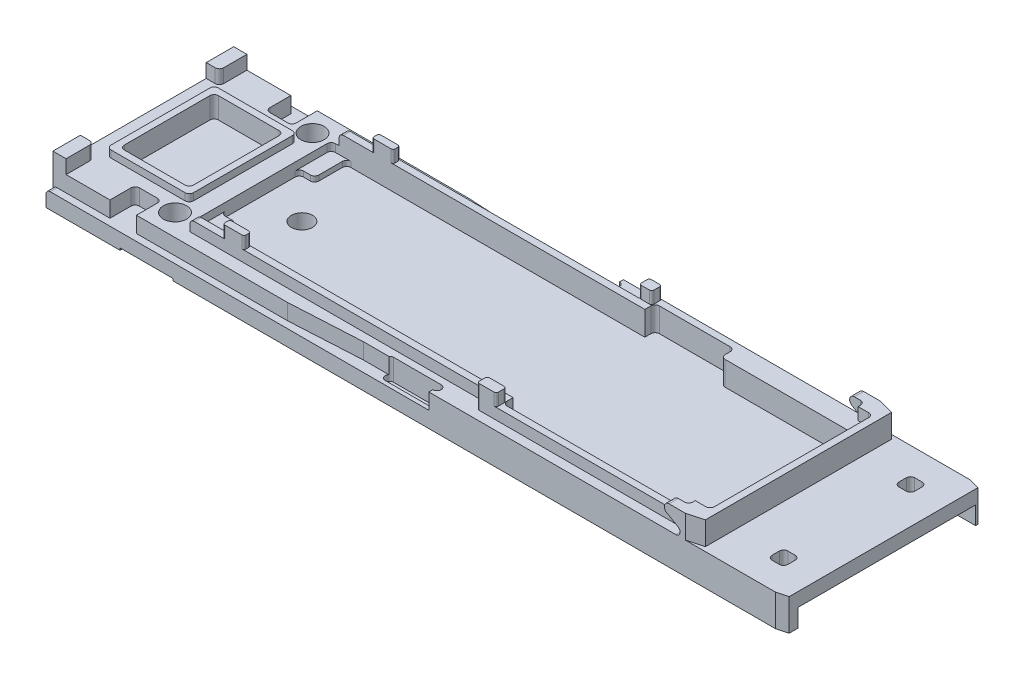
from build123d import *
from OCP.BRepFilletAPI import BRepFilletAPI_MakeChamfer

# Parameters (mm, degrees)
SKETCH1_W                                    = 70
SKETCH1_H                                    = 18.4
BOSS_EXTRUDE1_DEPTH                          = 4.05
CUT_EXTRUDE1_DEPTH                           = 2.28
SKETCH5_W                                    = 6.55
SKETCH5_H                                    = 8.9
CUT_EXTRUDE2_DEPTH                           = 2.38
SKETCH17_W                                   = 70
SKETCH17_H                                   = 18.4
CUT_EXTRUDE8_DEPTH                           = 1.05
SKETCH18_W                                   = 7.8
SKETCH18_H                                   = 10.15
SKETCH18_W_2                                 = 6.55
SKETCH18_H_2                                 = 8.9
BOSS_EXTRUDE3_DEPTH                          = 3.67
CSK_FOR_M2_COUNTERSUNK_FLAT_HEAD_SCR_2_COUNT = 2
CSK_FOR_M2_COUNTERSUNK_FLAT_HEAD_SCR_2_PITCH = 13
CUT_EXTRUDE5_DEPTH                           = 2.55
SKETCH19_W                                   = 1.25
SKETCH19_H                                   = 2.6
BOSS_EXTRUDE4_DEPTH                          = 4.3
SKETCH20_W                                   = 2.5
SKETCH20_H                                   = 2.385
CUT_EXTRUDE9_DEPTH                           = 1.5
SKETCH21_W                                   = 2
SKETCH21_H                                   = 0.65
BOSS_EXTRUDE5_DEPTH                          = 5.2
BOSS_EXTRUDE6_DEPTH                          = 5.2
CHAMFER2_SIZE                                = 1.5
CHAMFER2_SIZE2                               = 0.401923789
CHAMFER1_SIZE                                = 1
CHAMFER1_SIZE2                               = 0.267949192
CUT_EXTRUDE10_DEPTH                          = 37.313083042
CUT_EXTRUDE7_DEPTH                           = 0.2
CHAMFER2_OF_MIRROR1_SIZE2                    = 1.5
CHAMFER2_OF_MIRROR1_SIZE                     = 0.401923789
CUT_EXTRUDE12_DEPTH                          = 0.875
CUT_EXTRUDE13_START                          = -0.875
CUT_EXTRUDE13_DEPTH                          = 0.875
SKETCH26_W                                   = 1.8
SKETCH26_H                                   = 0.95
SKETCH26_W_2                                 = 1.18
BOSS_EXTRUDE8_DEPTH                          = 5.2
FILLET1_R                                    = 0.4
FILLET2_R                                    = 0.2
SKETCH23_W                                   = 0.65
SKETCH23_H                                   = 15.4
BOSS_EXTRUDE7_DEPTH                          = 1.15
SKETCH27_W                                   = 13.1
SKETCH27_H                                   = 1.275
BOSS_EXTRUDE9_DEPTH                          = 2.28
FILLET3_R                                    = 0.4
CUT_EXTRUDE11_DEPTH                          = 1.7
SKETCH31_W                                   = 1.45
SKETCH31_H                                   = 3.025
BOSS_EXTRUDE10_DEPTH                         = 0.5
SKETCH32_W                                   = 4.5
SKETCH32_H                                   = 0.65
CUT_EXTRUDE14_DEPTH                          = 0.55
CUT_EXTRUDE15_DEPTH                          = 37.43765223
FILLET5_R                                    = 0.4
FILLET6_R                                    = 0.4
FILLET7_R                                    = 0.4
FILLET8_R                                    = 0.4
SKETCH34_R                                   = 1
CUT_EXTRUDE16_DEPTH                          = 37.351133407


with BuildPart() as part:
    # Sketch1 → Boss-Extrude1 (new body)
    with BuildSketch(Plane(origin=(0, 0, 0), x_dir=(1, 0, 0), z_dir=(0, 1, 0))):
        Rectangle(SKETCH1_W, SKETCH1_H)
    extrude(amount=BOSS_EXTRUDE1_DEPTH)

    # Sketch2 → Cut-Extrude1 (cut)
    with BuildSketch(Plane(origin=(0, 4.05, 0), x_dir=(1, 0, 0), z_dir=(0, 1, 0))):
        Polygon((-23.95, 6.725), (-23.95, -6.725), (6.7, -6.725), (6.7, -7.7), (26.3, -7.7), (26.3, 7.7), (5.7, 7.7), (5.7, 6.725), align=None)
    extrude(amount=-CUT_EXTRUDE1_DEPTH, mode=Mode.SUBTRACT)

    # Sketch5 → Cut-Extrude2 (cut)
    with BuildSketch(Plane(origin=(0, 4.05, 0), x_dir=(1, 0, 0), z_dir=(0, 1, 0))):
        with Locations((-29.475, 0)):
            Rectangle(SKETCH5_W, SKETCH5_H)
    extrude(amount=-CUT_EXTRUDE2_DEPTH, mode=Mode.SUBTRACT)

    # Sketch17 → Cut-Extrude8 (cut)
    with BuildSketch(Plane(origin=(0, 4.05, 0), x_dir=(1, 0, 0), z_dir=(0, 1, 0))):
        Rectangle(SKETCH17_W, SKETCH17_H)
        Polygon((-23.2, 7.375), (-23.2, -7.375), (5.05, -7.375), (5.05, -8.325), (26.95, -8.325), (26.95, 8.325), (5.05, 8.325), (5.05, 7.375), align=None, mode=Mode.SUBTRACT)
    extrude(amount=-CUT_EXTRUDE8_DEPTH, mode=Mode.SUBTRACT)

    # Sketch18 → Boss-Extrude3 (add)
    with BuildSketch(Plane(origin=(0, 0, 0), x_dir=(1, 0, 0), z_dir=(0, 1, 0))):
        with Locations((-29.475, 0)):
            Rectangle(SKETCH18_W, SKETCH18_H)
        with Locations((-29.475, 0)):
            Rectangle(SKETCH18_W_2, SKETCH18_H_2, mode=Mode.SUBTRACT)
    extrude(amount=BOSS_EXTRUDE3_DEPTH)

    # Sketch6 → CSK for M2 Countersunk Flat Head Screw1 (revolve, cut)
    with BuildSketch(Plane(origin=(-25.5, 0, -6.5), x_dir=(0, 0, -1), z_dir=(1, 0, 0))):
        Polygon((0, 0), (0, 4.05), (1.1, 4.05), (1.1, 1.3), (2.2, 0.2), (2.2, 0), align=None)
    csk_for_m2_countersunk_flat_head_screw1 = revolve(axis=Axis((-25.5, -6.35, -6.5), (0, 1, 0)), mode=Mode.SUBTRACT)

    # CSK for M2 Countersunk Flat Head Scr 2: CSK for M2 Countersunk Flat Head Screw1 ×2
    with Locations(*[(0, 0, i * CSK_FOR_M2_COUNTERSUNK_FLAT_HEAD_SCR_2_PITCH) for i in range(1, CSK_FOR_M2_COUNTERSUNK_FLAT_HEAD_SCR_2_COUNT)]):
        add(csk_for_m2_countersunk_flat_head_screw1, mode=Mode.SUBTRACT)

    # Sketch13 → Cut-Extrude5 (cut)
    with BuildSketch(Plane(origin=(0, 4.05, 0), x_dir=(1, 0, 0), z_dir=(0, 1, 0))):
        Polygon((-35, 9.2), (1.2, 9.2), (1.2, 8.175), (-6, 8.175), (-12.8, 8.55), (-35, 8.55), align=None)
    cut_extrude5 = extrude(amount=-CUT_EXTRUDE5_DEPTH, mode=Mode.SUBTRACT)

    # Sketch19 → Boss-Extrude4 (add)
    with BuildSketch(Plane(origin=(0, 0, 0), x_dir=(1, 0, 0), z_dir=(0, 1, 0))):
        with Locations((-34.375, 7.25)):
            Rectangle(SKETCH19_W, SKETCH19_H)
    boss_extrude4 = extrude(amount=BOSS_EXTRUDE4_DEPTH)

    # Sketch20 → Cut-Extrude9 (cut)
    with BuildSketch(Plane(origin=(0, 3, 0), x_dir=(1, 0, 0), z_dir=(0, 1, 0))):
        with Locations((-28.35, 7.3575)):
            Rectangle(SKETCH20_W, SKETCH20_H)
    cut_extrude9 = extrude(amount=-CUT_EXTRUDE9_DEPTH, mode=Mode.SUBTRACT)

    # Sketch21 → Boss-Extrude5 (add)
    with BuildSketch(Plane(origin=(0, 0, 0), x_dir=(1, 0, 0), z_dir=(0, 1, 0))):
        with Locations((-19.1, 7.05)):
            Rectangle(SKETCH21_W, SKETCH21_H)
    boss_extrude5 = extrude(amount=BOSS_EXTRUDE5_DEPTH)

    # Sketch22 → Boss-Extrude6 (add)
    with BuildSketch(Plane.XZ):
        Polygon((24.9, -7.7), (26.95, -7.7), (26.95, -9.2), (22.15, -9.2), (22.15, -8.325), (24.9, -8.325), align=None)
    boss_extrude6 = extrude(amount=-BOSS_EXTRUDE6_DEPTH)

    # Chamfer2
    chamfer2_edges = [part.edges().sort_by_distance(p)[0] for p in [
        (26.95, 4.1, -9.2),
    ]]
    chamfer2_side = [part.faces().sort_by_distance(p)[0] for p in [
        (7.078780224, 1.420191267, -9.2),
    ]]
    chamfer(chamfer2_edges, length=CHAMFER2_SIZE, length2=CHAMFER2_SIZE2, reference=chamfer2_side[0])

    # Chamfer1: one chamfer whose edges measure the first distance from different faces: ONE call of the kernel's chamfer builder (chamfer() names one face for all edges)
    chamfer1_edges_1 = [part.edges().sort_by_distance(p)[0] for p in [
        (35, 1.5, 9.2),
    ]]
    chamfer1_side_1 = [part.faces().sort_by_distance(p)[0] for p in [
        (0, 1.5, 9.2),
    ]]
    chamfer1_edges_2 = [part.edges().sort_by_distance(p)[0] for p in [
        (35, 1.5, -9.2),
    ]]
    chamfer1_side_2 = [part.faces().sort_by_distance(p)[0] for p in [
        (6.691568483, 1.365924153, -9.2),
    ]]
    chamfer1 = BRepFilletAPI_MakeChamfer(part.part.solid().wrapped)
    for e in chamfer1_edges_1:
        chamfer1.Add(CHAMFER1_SIZE, CHAMFER1_SIZE2, e.wrapped, chamfer1_side_1[0].wrapped)  # the first distance lies on this face
    for e in chamfer1_edges_2:
        chamfer1.Add(CHAMFER1_SIZE, CHAMFER1_SIZE2, e.wrapped, chamfer1_side_2[0].wrapped)  # the first distance lies on this face
    add(Compound.cast(chamfer1.Shape()), mode=Mode.REPLACE)

    # Sketch25 → Cut-Extrude10 (cut, through all)
    with BuildSketch(Plane(origin=(0, 3, 0), x_dir=(1, 0, 0), z_dir=(0, 1, 0))):
        with BuildLine():
            Line((31.2, 6.75), (31.9, 6.75))
            ThreePointArc((31.9, 6.75), (32.182842712, 6.632842712), (32.3, 6.35))
            Line((32.3, 6.35), (32.3, 5.65))
            ThreePointArc((32.3, 5.65), (32.182842712, 5.367157288), (31.9, 5.25))
            Line((31.9, 5.25), (31.2, 5.25))
            ThreePointArc((31.2, 5.25), (30.917157288, 5.367157288), (30.8, 5.65))
            Line((30.8, 5.65), (30.8, 6.35))
            ThreePointArc((30.8, 6.35), (30.917157288, 6.632842712), (31.2, 6.75))
        make_face()
    cut_extrude10 = extrude(amount=-CUT_EXTRUDE10_DEPTH, mode=Mode.SUBTRACT)

    # Sketch16 → Cut-Extrude7 (cut)
    with BuildSketch(Plane.XZ):
        with BuildLine():
            Line((-28, -9.2), (-28, -6.5))
            ThreePointArc((-28, -6.5), (-25.5, -4), (-23, -6.5))
            Line((-23, -6.5), (-23, -9.2))
            Line((-23, -9.2), (-28, -9.2))
        make_face()
    cut_extrude7 = extrude(amount=-CUT_EXTRUDE7_DEPTH, mode=Mode.SUBTRACT)

    # Mirror1: Cut-Extrude5, Boss-Extrude4, Cut-Extrude9, Boss-Extrude5, Boss-Extrude6, Cut-Extrude10, Cut-Extrude7 across plane
    add(cut_extrude5.mirror(Plane.XY), mode=Mode.SUBTRACT)
    add(boss_extrude4.mirror(Plane.XY))
    add(cut_extrude9.mirror(Plane.XY), mode=Mode.SUBTRACT)
    add(boss_extrude5.mirror(Plane.XY))
    add(boss_extrude6.mirror(Plane.XY))
    add(cut_extrude10.mirror(Plane.XY), mode=Mode.SUBTRACT)
    add(cut_extrude7.mirror(Plane.XY), mode=Mode.SUBTRACT)

    # Chamfer2 of Mirror1
    chamfer2_of_mirror1_edges = [part.edges().sort_by_distance(p)[0] for p in [
        (26.95, 4.1, 9.2),
    ]]
    chamfer(chamfer2_of_mirror1_edges, length=CHAMFER2_OF_MIRROR1_SIZE, length2=CHAMFER2_OF_MIRROR1_SIZE2)

    # Sketch29 → Cut-Extrude12 (cut)
    with BuildSketch(Plane.XY.offset(-9.2)):
        with BuildLine():
            Line((23.693911087, 4.360288568), (24.757179677, 3.746410162))
            ThreePointArc((24.757179677, 3.746410162), (24.943550007, 3.296472382), (24.557179677, 3))
            Line((24.557179677, 3), (21.557179677, 3))
            Line((21.557179677, 3), (21.557179677, 5.2))
            Line((21.557179677, 5.2), (23.918911087, 5.2))
            ThreePointArc((23.918911087, 5.2), (23.484244465, 4.86646857), (23.693911087, 4.360288568))
        make_face()
    extrude(amount=CUT_EXTRUDE12_DEPTH, mode=Mode.SUBTRACT)

    # Sketch30 → Cut-Extrude13 (cut)
    with BuildSketch(Plane.XY.offset(9.2).offset(CUT_EXTRUDE13_START)):
        with BuildLine():
            Line((23.693911087, 4.360288568), (24.757179677, 3.746410162))
            ThreePointArc((24.757179677, 3.746410162), (24.943550007, 3.296472382), (24.557179677, 3))
            Line((24.557179677, 3), (21.557179677, 3))
            Line((21.557179677, 3), (21.557179677, 5.2))
            Line((21.557179677, 5.2), (23.918911087, 5.2))
            ThreePointArc((23.918911087, 5.2), (23.484244465, 4.86646857), (23.693911087, 4.360288568))
        make_face()
    extrude(amount=CUT_EXTRUDE13_DEPTH, mode=Mode.SUBTRACT)

    # Sketch26 → Boss-Extrude8 (add)
    with BuildSketch(Plane.XZ):
        with Locations((5.8, 7.85)):
            Rectangle(SKETCH26_W, SKETCH26_H)
        with Locations((5.11, -7.85)):
            Rectangle(SKETCH26_W_2, SKETCH26_H)
    extrude(amount=-BOSS_EXTRUDE8_DEPTH)

    # Fillet1
    fillet1_edges = [part.edges().sort_by_distance(p)[0] for p in [
        (-23.2, 4.05, -7.05),
        (-23.2, 4.05, 7.05),
    ]]
    fillet(fillet1_edges, radius=FILLET1_R)

    # Fillet2
    fillet2_edges = [part.edges().sort_by_distance(p)[0] for p in [
        (-20.1, 4.625, -7.375),
        (-20.1, 4.625, -6.725),
        (-18.1, 4.625, -6.725),
        (-18.1, 4.625, -7.375),
        (-20.1, 4.625, 6.725),
        (-20.1, 4.625, 7.375),
        (-18.1, 4.625, 7.375),
        (-18.1, 4.625, 6.725),
        (4.9, 4.1, 8.325),
        (6.7, 4.625, 7.375),
        (6.7, 4.625, 8.325),
        (4.9, 4.625, 7.375),
        (5.7, 4.625, -7.375),
        (5.7, 4.625, -8.325),
        (4.52, 4.1, -8.325),
        (4.52, 4.625, -7.375),
    ]]
    fillet(fillet2_edges, radius=FILLET2_R)

    # Sketch23 → Boss-Extrude7 (add)
    with BuildSketch(Plane(origin=(0, 4.05, 0), x_dir=(1, 0, 0), z_dir=(0, 1, 0))):
        with Locations((26.625, 0)):
            Rectangle(SKETCH23_W, SKETCH23_H)
    extrude(amount=BOSS_EXTRUDE7_DEPTH)

    # Sketch27 → Boss-Extrude9 (add)
    with BuildSketch(Plane(origin=(0, 1.77, 0), x_dir=(1, 0, 0), z_dir=(0, 1, 0))):
        with Locations((19.75, 7.0625)):
            Rectangle(SKETCH27_W, SKETCH27_H)
    extrude(amount=BOSS_EXTRUDE9_DEPTH)

    # Fillet3
    fillet3_edges = [part.edges().sort_by_distance(p)[0] for p in [
        (13.2, 2.91, -7.7),
        (13.2, 2.91, -6.425),
    ]]
    fillet(fillet3_edges, radius=FILLET3_R)

    # Sketch28 → Cut-Extrude11 (cut)
    with BuildSketch(Plane.XZ):
        Polygon((35, 8.1), (30.8, 8.1), (30.8, -7), (14.2, -7), (14.2, -8.7), (35, -8.7), align=None)
    extrude(amount=-CUT_EXTRUDE11_DEPTH, mode=Mode.SUBTRACT)

    # Sketch31 → Boss-Extrude10 (add)
    with BuildSketch(Plane(origin=(0, 1.77, 0), x_dir=(1, 0, 0), z_dir=(0, 1, 0))):
        with Locations((-23.225, 5.2125)):
            Rectangle(SKETCH31_W, SKETCH31_H)
        with Locations((-23.225, -5.2125)):
            Rectangle(SKETCH31_W, SKETCH31_H)
    extrude(amount=BOSS_EXTRUDE10_DEPTH)

    # Sketch32 → Cut-Extrude14 (cut)
    with BuildSketch(Plane(origin=(0, 1.5, 0), x_dir=(1, 0, 0), z_dir=(0, 1, 0))):
        with Locations((-1.05, 8.5)):
            Rectangle(SKETCH32_W, SKETCH32_H)
        with Locations((-1.05, -8.5)):
            Rectangle(SKETCH32_W, SKETCH32_H)
    extrude(amount=-CUT_EXTRUDE14_DEPTH, mode=Mode.SUBTRACT)

    # Sketch33 → Cut-Extrude15 (cut, through all)
    with BuildSketch(Plane(origin=(0, 0.95, 0), x_dir=(1, 0, 0), z_dir=(0, 1, 0))):
        with BuildLine():
            Line((-3.3, -8.825), (1.2, -8.825))
            ThreePointArc((1.2, -8.825), (1.6, -8.425), (1.2, -8.025))
            Line((1.2, -8.025), (-3.3, -8.025))
            ThreePointArc((-3.3, -8.025), (-3.7, -8.425), (-3.3, -8.825))
        make_face()
    cut_extrude15 = extrude(amount=CUT_EXTRUDE15_DEPTH, mode=Mode.SUBTRACT)

    # Mirror2: Cut-Extrude15 across plane
    add(cut_extrude15.mirror(Plane.XY), mode=Mode.SUBTRACT)

    # Fillet5
    # the kernel refuses this fillet: 0.4 mm, written as the material it adds along each edge
    with BuildSketch(Plane(origin=(5.7, 4.05, -7.7), x_dir=(0, 0, 1), z_dir=(0, -1, 0)), Plane(origin=(6.7, 4.05, 7.7), x_dir=(1, 0, 0), z_dir=(0, -1, 0))) as fillet5_piece_1:
        with BuildLine():
            CenterArc((FILLET5_R, -FILLET5_R), FILLET5_R, 90, 90)
            Line((0, -FILLET5_R), (0, 0))
            Line((0, 0), (FILLET5_R, 0))
        make_face()
    extrude(amount=3.28)
    with BuildSketch(Plane(origin=(26.3, 5.2, 7.7), x_dir=(0, 0, -1), z_dir=(0, -1, 0))) as fillet5_piece_2:
        with BuildLine():
            CenterArc((FILLET5_R, -FILLET5_R), FILLET5_R, 90, 90)
            Line((0, -FILLET5_R), (0, 0))
            Line((0, 0), (FILLET5_R, 0))
        make_face()
    extrude(amount=4.43)
    with BuildSketch(Plane(origin=(-29.6, 3, -6.165), x_dir=(1, 0, 0), z_dir=(0, -1, 0)), Plane(origin=(-29.6, 3, 6.165), x_dir=(0, 0, 1), z_dir=(0, -1, 0))) as fillet5_piece_3:
        with BuildLine():
            CenterArc((FILLET5_R, -FILLET5_R), FILLET5_R, 90, 90)
            Line((0, -FILLET5_R), (0, 0))
            Line((0, 0), (FILLET5_R, 0))
        make_face()
    extrude(amount=2.5)
    with BuildSketch(Plane(origin=(-27.1, 3, -6.165), x_dir=(0, 0, -1), z_dir=(0, -1, 0)), Plane(origin=(-27.1, 3, 6.165), x_dir=(-1, 0, 0), z_dir=(0, -1, 0))) as fillet5_piece_4:
        with BuildLine():
            CenterArc((FILLET5_R, -FILLET5_R), FILLET5_R, 90, 90)
            Line((0, -FILLET5_R), (0, 0))
            Line((0, 0), (FILLET5_R, 0))
        make_face()
    extrude(amount=1.5)
    with BuildSketch(Plane(origin=(24.9, 3.05, -8.325), x_dir=(0, 0, 1), z_dir=(0, 1, 0))) as fillet5_piece_5:
        with BuildLine():
            CenterArc((FILLET5_R, -FILLET5_R), FILLET5_R, 90, 90)
            Line((0, -FILLET5_R), (0, 0))
            Line((0, 0), (FILLET5_R, 0))
        make_face()
    extrude(amount=2.15)
    with BuildSketch(Plane(origin=(-26.2, 0.67, -4.45), x_dir=(-1, 0, 0), z_dir=(0, 1, 0)), Plane(origin=(-26.2, 0.67, 4.45), x_dir=(0, 0, -1), z_dir=(0, 1, 0)), Plane(origin=(-32.75, 0.67, 4.45), x_dir=(1, 0, 0), z_dir=(0, 1, 0)), Plane(origin=(-32.75, 3.67, -4.45), x_dir=(1, 0, 0), z_dir=(0, -1, 0))) as fillet5_piece_6:
        with BuildLine():
            CenterArc((FILLET5_R, FILLET5_R), FILLET5_R, 180, 90)
            Line((0, FILLET5_R), (0, 0))
            Line((0, 0), (FILLET5_R, 0))
        make_face()
    extrude(amount=3)
    with BuildSketch(Plane(origin=(24.9, 3.05, 8.325), x_dir=(0, 0, -1), z_dir=(0, 1, 0)), Plane(origin=(26.3, 5.2, -7.7), x_dir=(0, 0, 1), z_dir=(0, -1, 0))) as fillet5_piece_7:
        with BuildLine():
            CenterArc((FILLET5_R, FILLET5_R), FILLET5_R, 180, 90)
            Line((0, FILLET5_R), (0, 0))
            Line((0, 0), (FILLET5_R, 0))
        make_face()
    extrude(amount=2.15)
    with BuildSketch(Plane(origin=(26.3, 0.77, -6.425), x_dir=(-1, 0, 0), z_dir=(0, 1, 0))) as fillet5_piece_8:
        with BuildLine():
            CenterArc((FILLET5_R, FILLET5_R), FILLET5_R, 180, 90)
            Line((0, FILLET5_R), (0, 0))
            Line((0, 0), (FILLET5_R, 0))
        make_face()
    extrude(amount=3.28)
    with BuildSketch(Plane(origin=(14.2, 0, -8.7), x_dir=(1, 0, 0), z_dir=(0, 1, 0)), Plane(origin=(14.2, 0, -7), x_dir=(0, 0, -1), z_dir=(0, 1, 0)), Plane(origin=(30.8, 0, 8.1), x_dir=(0, 0, -1), z_dir=(0, 1, 0))) as fillet5_piece_9:
        with BuildLine():
            CenterArc((FILLET5_R, -FILLET5_R), FILLET5_R, 90, 90)
            Line((0, -FILLET5_R), (0, 0))
            Line((0, 0), (FILLET5_R, 0))
        make_face()
    extrude(amount=2.7)
    with BuildSketch(Plane(origin=(-23.95, 3, -6.725), x_dir=(0, 0, 1), z_dir=(0, -1, 0)), Plane(origin=(-23.95, 3, 6.725), x_dir=(1, 0, 0), z_dir=(0, -1, 0))) as fillet5_piece_10:
        with BuildLine():
            CenterArc((FILLET5_R, -FILLET5_R), FILLET5_R, 90, 90)
            Line((0, -FILLET5_R), (0, 0))
            Line((0, 0), (FILLET5_R, 0))
        make_face()
    extrude(amount=1.73)
    with BuildSketch(Plane(origin=(-23.95, 0.77, -3.7), x_dir=(0, 0, 1), z_dir=(0, 1, 0)), Plane(origin=(-22.5, 0.77, -6.725), x_dir=(0, 0, 1), z_dir=(0, 1, 0)), Plane(origin=(-23.95, 0.77, 3.7), x_dir=(1, 0, 0), z_dir=(0, 1, 0)), Plane(origin=(-22.5, 0.77, 6.725), x_dir=(1, 0, 0), z_dir=(0, 1, 0))) as fillet5_piece_11:
        with BuildLine():
            CenterArc((FILLET5_R, FILLET5_R), FILLET5_R, 180, 90)
            Line((0, FILLET5_R), (0, 0))
            Line((0, 0), (FILLET5_R, 0))
        make_face()
    extrude(amount=1.5)

    # Fillet6
    fillet6_edges = [part.edges().sort_by_distance(p)[0] for p in [
        (-22.5, 2.02, -3.7),
        (-22.5, 2.02, 3.7),
    ]]
    fillet(fillet6_edges, radius=FILLET6_R)

    # Fillet7
    fillet7_edges = [part.edges().sort_by_distance(p)[0] for p in [
        (-35, 1.5, -8.875),
        (-35, 1.5, 8.875),
    ]]
    fillet(fillet7_edges, radius=FILLET7_R)

    # Fillet8
    fillet8_edges = [part.edges().sort_by_distance(p)[0] for p in [
        (-25.575, 3.335, -5.075),
        (-33.375, 3.335, -5.075),
        (-33.375, 3.335, 5.075),
        (-25.575, 3.335, 5.075),
        (-33.75, 3.65, -5.95),
        (-33.75, 3.65, 5.95),
    ]]
    fillet(fillet8_edges, radius=FILLET8_R)

    # Sketch34 → Cut-Extrude16 (cut, through all)
    with BuildSketch(Plane(origin=(0, 1.77, 0), x_dir=(1, 0, 0), z_dir=(0, 1, 0))):
        with Locations(Location((-20, 0, 0), (0, 0, 270))):
            Circle(SKETCH34_R)
    extrude(amount=-CUT_EXTRUDE16_DEPTH, mode=Mode.SUBTRACT)


solid = part.part
